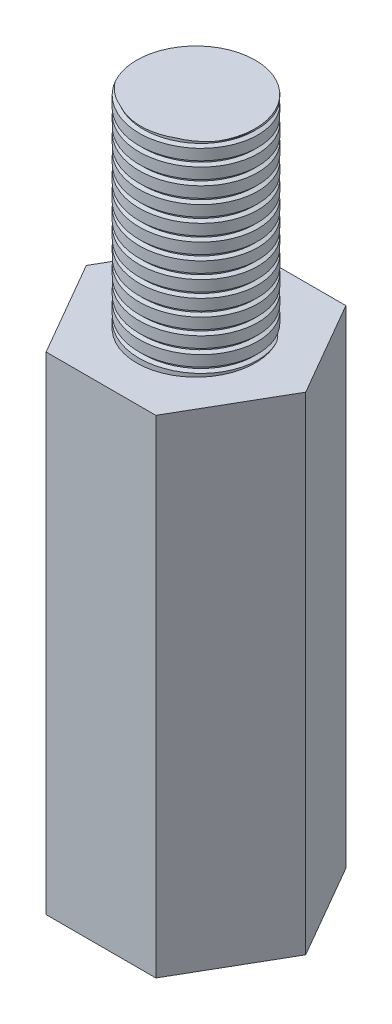
from build123d import *

# Parameters (mm, degrees)
SKETCH_1_R          = 1.46
EXTRUDE_1_DEPTH     = 12
SKETCH_1_3_R        = 1.46
CUT_EXTRUDE_1_DEPTH = 5
SKETCH_2_R          = 1.46
EXTRUDE_2_DEPTH     = 5
SWEEP_1_PITCH       = 0.4
SWEEP_1_FROM        = -0.1
SWEEP_2_PITCH       = 0.4


with BuildPart() as part:
    # 草图1 → 凸台-拉伸1 (new body)
    # profile 1 of 2: a face of its own
    with BuildSketch(Plane(origin=(0, 0, 0), x_dir=(1, 0, 0), z_dir=(0, 1, 0))):
        Polygon((-2.70199926, 0), (-1.35099963, -2.34), (1.35099963, -2.34), (2.70199926, 0), (1.35099963, 2.34), (-1.35099963, 2.34), align=None)
        Circle(SKETCH_1_R, mode=Mode.SUBTRACT)
    # profile 2 of 2: a face of its own
    with BuildSketch(Plane(origin=(0, 0, 0), x_dir=(1, 0, 0), z_dir=(0, 1, 0))):
        Circle(SKETCH_1_R)
    extrude(amount=EXTRUDE_1_DEPTH)

    # 草图1<3> → 切除-拉伸1 (cut)
    with BuildSketch(Plane(origin=(0, 0, 0), x_dir=(1, 0, 0), z_dir=(0, 1, 0))):
        with Locations(Location((0, 0, 0), (0, 0, 270))):
            Circle(SKETCH_1_3_R)
    extrude(amount=CUT_EXTRUDE_1_DEPTH, mode=Mode.SUBTRACT)

    # 切除-扫描2: arcs per turn and ends read off the stored shape
    # 切除-扫描2: the profile of 草图7 profile screwed along a right-hand helix through 23.75 turns, 6 arcs to a turn; built about Z, then put on its axis
    sweep_2_z = Axis((0, 0, 0), (0, 0, 1))
    sweep_2_corners = [(1.4597, 0, 0.1001), (1.66, 0, 0.033333333), (1.66, 0, -0.033333333), (1.4597, 0, -0.1001)]
    with BuildLine(mode=Mode.PRIVATE) as sweep_2_profile:
        Line(sweep_2_corners[0], sweep_2_corners[1])
        Line(sweep_2_corners[1], sweep_2_corners[2])
        Line(sweep_2_corners[2], sweep_2_corners[3])
        Line(sweep_2_corners[3], sweep_2_corners[0])
    sweep_2_cap = Face(sweep_2_profile.wire())
    sweep_2_turn_angles = [0, 30, 60, 90, 120, 150, 180, 210, 240, 270, 300, 330, 360]
    sweep_2_turn_weights = [1, 0.8660254037844387, 1, 0.8660254037844387, 1, 0.8660254037844387, 1, 0.8660254037844387, 1, 0.8660254037844387, 1, 0.8660254037844387, 1]
    sweep_2_turn_rails = [Edge.make_bspline([Vector(p[0], p[1], 0).rotate(sweep_2_z, sweep_2_turn_angles[k]) / sweep_2_turn_weights[k] + Vector(0, 0, p[2] + SWEEP_2_PITCH * sweep_2_turn_angles[k] / 360) for k in range(13)], [0, 0, 0, 1, 1, 2, 2, 3, 3, 4, 4, 5, 5, 6, 6, 6], 2, sweep_2_turn_weights) for p in sweep_2_corners]
    sweep_2_turn_sides = [Face.make_surface_from_curves(sweep_2_turn_rails[p[0]], sweep_2_turn_rails[p[1]]) for p in [(0, 1), (1, 2), (2, 3), (3, 0)]]
    sweep_2_last_angles = [8280, 8310, 8340, 8370, 8400, 8430, 8460, 8490, 8520, 8535, 8550]
    sweep_2_last_weights = [1, 0.8660254037844387, 1, 0.8660254037844387, 1, 0.8660254037844387, 1, 0.8660254037844387, 1, 0.965925826289056, 1]
    sweep_2_last_rails = [Edge.make_bspline([Vector(p[0], p[1], 0).rotate(sweep_2_z, sweep_2_last_angles[k]) / sweep_2_last_weights[k] + Vector(0, 0, p[2] + SWEEP_2_PITCH * sweep_2_last_angles[k] / 360) for k in range(11)], [0, 0, 0, 1, 1, 2, 2, 3, 3, 4, 4, 5, 5, 5], 2, sweep_2_last_weights) for p in sweep_2_corners]
    sweep_2_last_sides = [Face.make_surface_from_curves(sweep_2_last_rails[p[0]], sweep_2_last_rails[p[1]]) for p in [(0, 1), (1, 2), (2, 3), (3, 0)]]
    sweep_2 = Plane(origin=(0, 0, 0), x_dir=(0, 0, -1), z_dir=(0, 1, 0)) * Solid(Shell([*[p.moved(Location((0, 0, SWEEP_2_PITCH * i))) for i in range(23) for p in sweep_2_turn_sides], *sweep_2_last_sides, sweep_2_cap, sweep_2_cap.rotate(sweep_2_z, 8550).moved(Location((0, 0, SWEEP_2_PITCH * 8550 / 360)))]))
    add(sweep_2, mode=Mode.SUBTRACT)


with BuildPart() as body_2:
    # 草图2 → 凸台-拉伸2 (new body)
    with BuildSketch(Plane(origin=(0, 12, 0), x_dir=(1, 0, 0), z_dir=(0, 1, 0))):
        with Locations(Location((0, 0, 0), (0, 0, 270))):
            Circle(SKETCH_2_R)
    extrude(amount=EXTRUDE_2_DEPTH)

    # 切除-扫描1: arcs per turn and ends read off the stored shape
    # 切除-扫描1: the profile of 草图4 screwed along a left-hand helix through 18.75 turns, 6 arcs to a turn; built about Z, then put on its axis
    sweep_1_z = Axis((0, 0, 0), (0, 0, 1))
    sweep_1_corners = [(1.56, 5.45e-07, -0.400000022), (1.56, 5.45e-07, -0.200000022), (1.36, 4.75e-07, -0.266666689), (1.36, 4.75e-07, -0.333333356)]
    with BuildLine(mode=Mode.PRIVATE) as sweep_1_profile:
        Line(sweep_1_corners[0], sweep_1_corners[1])
        Line(sweep_1_corners[1], sweep_1_corners[2])
        Line(sweep_1_corners[2], sweep_1_corners[3])
        Line(sweep_1_corners[3], sweep_1_corners[0])
    sweep_1_cap = Face(sweep_1_profile.wire())
    sweep_1_turn_angles = [0, -30, -60, -90, -120, -150, -180, -210, -240, -270, -300, -330, -360]
    sweep_1_turn_weights = [1, 0.8660254037844387, 1, 0.8660254037844387, 1, 0.8660254037844387, 1, 0.8660254037844387, 1, 0.8660254037844387, 1, 0.8660254037844387, 1]
    sweep_1_turn_rails = [Edge.make_bspline([Vector(p[0], p[1], 0).rotate(sweep_1_z, sweep_1_turn_angles[k]) / sweep_1_turn_weights[k] + Vector(0, 0, p[2] + -SWEEP_1_PITCH * sweep_1_turn_angles[k] / 360) for k in range(13)], [0, 0, 0, 1, 1, 2, 2, 3, 3, 4, 4, 5, 5, 6, 6, 6], 2, sweep_1_turn_weights) for p in sweep_1_corners]
    sweep_1_turn_sides = [Face.make_surface_from_curves(sweep_1_turn_rails[p[0]], sweep_1_turn_rails[p[1]]) for p in [(0, 1), (1, 2), (2, 3), (3, 0)]]
    sweep_1_last_angles = [-6480, -6510, -6540, -6570, -6600, -6630, -6660, -6690, -6720, -6735, -6750]
    sweep_1_last_weights = [1, 0.8660254037844387, 1, 0.8660254037844387, 1, 0.8660254037844387, 1, 0.8660254037844387, 1, 0.965925826288941, 1]
    sweep_1_last_rails = [Edge.make_bspline([Vector(p[0], p[1], 0).rotate(sweep_1_z, sweep_1_last_angles[k]) / sweep_1_last_weights[k] + Vector(0, 0, p[2] + -SWEEP_1_PITCH * sweep_1_last_angles[k] / 360) for k in range(11)], [0, 0, 0, 1, 1, 2, 2, 3, 3, 4, 4, 5, 5, 5], 2, sweep_1_last_weights) for p in sweep_1_corners]
    sweep_1_last_sides = [Face.make_surface_from_curves(sweep_1_last_rails[p[0]], sweep_1_last_rails[p[1]]) for p in [(0, 1), (1, 2), (2, 3), (3, 0)]]
    sweep_1 = Plane(origin=(0, 12.1, 0), x_dir=(0, 0, 1), z_dir=(0, 1, 0)) * split(Solid(Shell([*[p.moved(Location((0, 0, SWEEP_1_PITCH * i))) for i in range(18) for p in sweep_1_turn_sides], *sweep_1_last_sides, sweep_1_cap, sweep_1_cap.rotate(sweep_1_z, -6750).moved(Location((0, 0, -SWEEP_1_PITCH * -6750 / 360)))])), bisect_by=Plane.XY.offset(SWEEP_1_FROM), keep=Keep.TOP, mode=Mode.PRIVATE)
    add(sweep_1, mode=Mode.SUBTRACT)


solid = Compound([part.part, body_2.part])
